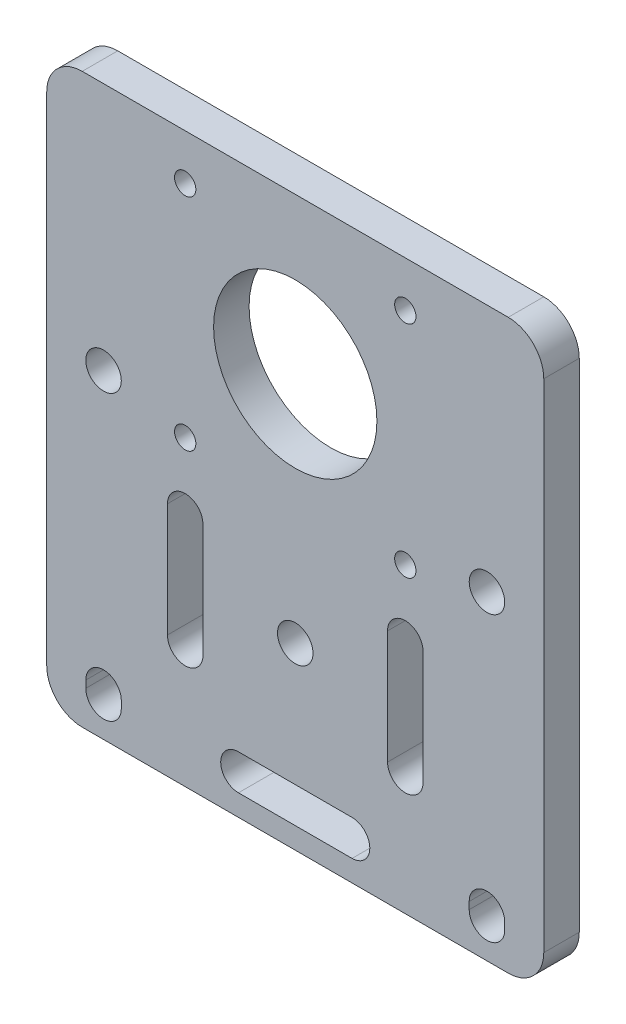
from build123d import *

# Parameters (mm, degrees)
SKETCH4_W           = 70
SKETCH4_H           = 80
SKETCH4_R           = 2.5
BOSS_EXTRUDE2_DEPTH = 5
SKETCH5_R           = 11.5
SKETCH5_R_2         = 1.5
SKETCH5_R_3         = 2.5
CUT_EXTRUDE2_DEPTH  = 54.38539126
FILLET1_R           = 5


with BuildPart() as part:
    # Sketch4 → Boss-Extrude2 (new body)
    with BuildSketch(Plane.XY):
        Rectangle(SKETCH4_W, SKETCH4_H)
        with Locations((-27, 5)):
            Circle(SKETCH4_R, mode=Mode.SUBTRACT)
        with Locations((27, 5)):
            Circle(SKETCH4_R, mode=Mode.SUBTRACT)
        with BuildLine():
            Line((-24.5, -34), (-24.5, -35))
            ThreePointArc((-24.5, -35), (-27, -37.5), (-29.5, -35))
            Line((-29.5, -35), (-29.5, -34))
            ThreePointArc((-29.5, -34), (-27, -31.5), (-24.5, -34))
        make_face(mode=Mode.SUBTRACT)
        with BuildLine():
            Line((24.5, -34), (24.5, -35))
            ThreePointArc((24.5, -35), (27, -37.5), (29.5, -35))
            Line((29.5, -35), (29.5, -34))
            ThreePointArc((29.5, -34), (27, -31.5), (24.5, -34))
        make_face(mode=Mode.SUBTRACT)
    extrude(amount=BOSS_EXTRUDE2_DEPTH)

    # Sketch5 → Cut-Extrude2 (cut, through all)
    with BuildSketch(Plane.XY.offset(5)):
        with Locations((0, 18.076696831)):
            Circle(SKETCH5_R)
        with Locations((-15.5, 33.576696831)):
            Circle(SKETCH5_R_2)
        with Locations((15.5, 33.576696831)):
            Circle(SKETCH5_R_2)
        with Locations((15.5, 2.576696831)):
            Circle(SKETCH5_R_2)
        with Locations((-15.5, 2.576696831)):
            Circle(SKETCH5_R_2)
        with Locations((0, -14.75)):
            Circle(SKETCH5_R_3)
        with BuildLine():
            Line((-8, -32), (8, -32))
            ThreePointArc((8, -32), (10.5, -34.5), (8, -37))
            Line((8, -37), (-8, -37))
            ThreePointArc((-8, -37), (-10.5, -34.5), (-8, -32))
        make_face()
        with BuildLine():
            Line((-13, -6.75), (-13, -22.75))
            ThreePointArc((-13, -22.75), (-15.5, -25.25), (-18, -22.75))
            Line((-18, -22.75), (-18, -6.75))
            ThreePointArc((-18, -6.75), (-15.5, -4.25), (-13, -6.75))
        make_face()
        with BuildLine():
            Line((13, -6.75), (13, -22.75))
            ThreePointArc((13, -22.75), (15.5, -25.25), (18, -22.75))
            Line((18, -22.75), (18, -6.75))
            ThreePointArc((18, -6.75), (15.5, -4.25), (13, -6.75))
        make_face()
    extrude(amount=-CUT_EXTRUDE2_DEPTH, mode=Mode.SUBTRACT)

    # Fillet1
    fillet1_edges = [part.edges().sort_by_distance(p)[0] for p in [
        (-35, -40, 2.5),
        (35, -40, 2.5),
        (35, 40, 2.5),
        (-35, 40, 2.5),
    ]]
    fillet(fillet1_edges, radius=FILLET1_R)


solid = part.part
